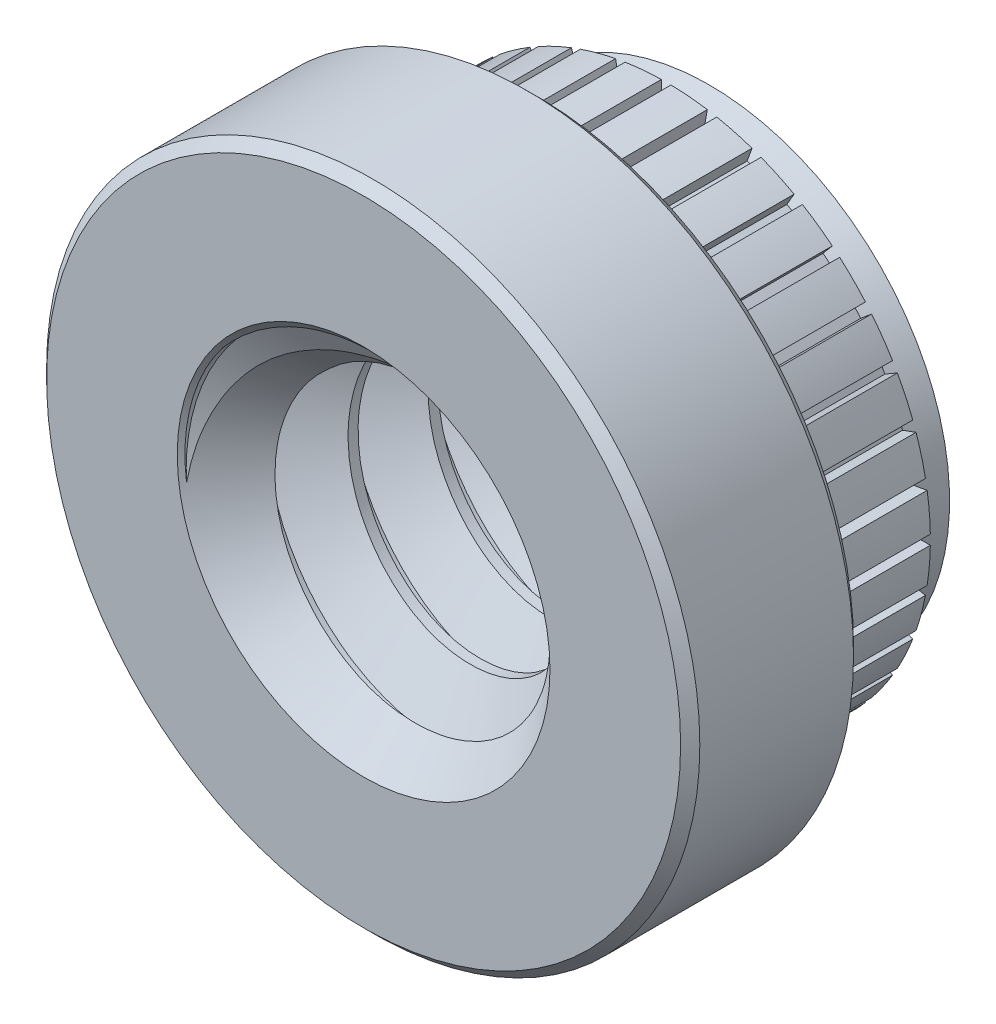
from build123d import *

# Parameters (mm, degrees)
SKETCH1_R               = 4.318
EXTRUDE1_DEPTH          = 2.286
SKETCH2_R               = 3.4925
EXTRUDE2_DEPTH          = 2.286
SKETCH3_W               = 0.127
SKETCH3_H               = 1.016
CUT_EXTRUDE_THIN1_DEPTH = 2.286
CIRPATTERN1_COUNT       = 36
SKETCH5_OUTSIDE_W       = 13.66
SKETCH5_OUTSIDE_H       = 13.66
SKETCH5_OUTSIDE_R       = 3.175
CUT_EXTRUDE1_DEPTH      = 0.5715
CUT_EXTRUDE1_DRAFT      = 20
CHAMFER2_SIZE           = 0.127
SKETCH7_R               = 2.413
CUT_EXTRUDE3_DEPTH      = 8.628461968
SWEEP1_PITCH            = 1.058333333
SKETCH10_R              = 4.318
CUT_EXTRUDE4_DEPTH      = 9.217092909
SKETCH11_R              = 3.175
CUT_EXTRUDE5_DEPTH      = 8.628462028


with BuildPart() as part:
    # Sketch1 → Extrude1 (new body)
    with BuildSketch(Plane.XY):
        Circle(SKETCH1_R)
    extrude(amount=-EXTRUDE1_DEPTH)

    # Sketch2 → Extrude2 (add)
    with BuildSketch(Plane(origin=(0, 0, -2.286), x_dir=(-1, 0, 0), z_dir=(0, 0, -1))):
        with Locations(Location((0, 0, 0), (0, 0, 180))):
            Circle(SKETCH2_R)
    extrude(amount=EXTRUDE2_DEPTH)

    # Sketch3 → Cut-Extrude-Thin1 (cut)
    with BuildSketch(Plane(origin=(0, 0, -4.572), x_dir=(-1, 0, 0), z_dir=(0, 0, -1))):
        with Locations((0, 3.81)):
            Rectangle(SKETCH3_W, SKETCH3_H)
    cut_extrude_thin1 = extrude(amount=-CUT_EXTRUDE_THIN1_DEPTH, mode=Mode.SUBTRACT)

    # CirPattern1: Cut-Extrude-Thin1 ×36 about axis
    cirpattern1_axis = Axis((0, 0, 0), (0, 0, 1))
    for i in range(1, CIRPATTERN1_COUNT):
        add(cut_extrude_thin1.rotate(cirpattern1_axis, i * 360 / CIRPATTERN1_COUNT), mode=Mode.SUBTRACT)


with BuildPart() as cut_extrude1_tool:
    # Sketch5 outside → Cut-Extrude1 (with draft: the straight prism first)
    with BuildSketch(Plane(origin=(0, 0, -4.572), x_dir=(-1, 0, 0), z_dir=(0, 0, -1))):
        Rectangle(SKETCH5_OUTSIDE_W, SKETCH5_OUTSIDE_H)
        Circle(SKETCH5_OUTSIDE_R, mode=Mode.SUBTRACT)
    extrude(amount=-CUT_EXTRUDE1_DEPTH)
    # Cut-Extrude1: the draft: its side faces are tilted about the plane it starts from
    cut_extrude1_sides = [cut_extrude1_tool.faces().sort_by_distance(p)[0] for p in [
        (0, -6.83, -4.28625),
        (-6.83, 0, -4.28625),
        (0, 6.83, -4.28625),
        (6.83, 0, -4.28625),
        (3.175, 0, -4.28625),
    ]]
    draft(cut_extrude1_sides, Plane(origin=(0, 0, -4.572), x_dir=(-1, 0, 0), z_dir=(0, 0, -1)), CUT_EXTRUDE1_DRAFT)


with BuildPart() as part_1:
    add(part.part)

    # Cut-Extrude1: cut by cut_extrude1_tool
    add(cut_extrude1_tool.part, mode=Mode.SUBTRACT)

    # Chamfer2
    chamfer2_edges = [part_1.edges().sort_by_distance(p)[0] for p in [
        (-4.318, 0, 0),
        (-4.318, 0, -2.286),
    ]]
    chamfer(chamfer2_edges, length=CHAMFER2_SIZE)

    # Sketch7 → Cut-Extrude3 (cut, through all)
    with BuildSketch(Plane.XY):
        Circle(SKETCH7_R)
    extrude(amount=-CUT_EXTRUDE3_DEPTH, mode=Mode.SUBTRACT)

    # Sweep1: the profile of Sketch9 profile screwed along a right-hand helix of 7.32 turns, 6 arcs to a turn; built about Z, then put on its axis
    sweep1_z = Axis((0, 0, 0), (0, 0, 1))
    sweep1_corners = [(2.4133, 0, -0.926214872), (1.725592336, 0, -0.529166667), (1.725592336, 0, -0.396875), (2.4133, 0, 0.000173205)]
    with BuildLine(mode=Mode.PRIVATE) as sweep1_profile:
        Line(sweep1_corners[0], sweep1_corners[1])
        Line(sweep1_corners[1], sweep1_corners[2])
        Line(sweep1_corners[2], sweep1_corners[3])
        Line(sweep1_corners[3], sweep1_corners[0])
    sweep1_cap = Face(sweep1_profile.wire())
    sweep1_turn_angles = [0, 30, 60, 90, 120, 150, 180, 210, 240, 270, 300, 330, 360]
    sweep1_turn_weights = [1, 0.8660254037844387, 1, 0.8660254037844387, 1, 0.8660254037844387, 1, 0.8660254037844387, 1, 0.8660254037844387, 1, 0.8660254037844387, 1]
    sweep1_turn_rails = [Edge.make_bspline([Vector(p[0], p[1], 0).rotate(sweep1_z, sweep1_turn_angles[k]) / sweep1_turn_weights[k] + Vector(0, 0, p[2] + SWEEP1_PITCH * sweep1_turn_angles[k] / 360) for k in range(13)], [0, 0, 0, 1, 1, 2, 2, 3, 3, 4, 4, 5, 5, 6, 6, 6], 2, sweep1_turn_weights) for p in sweep1_corners]
    sweep1_turn_sides = [Face.make_surface_from_curves(sweep1_turn_rails[p[0]], sweep1_turn_rails[p[1]]) for p in [(0, 1), (1, 2), (2, 3), (3, 0)]]
    sweep1_last_angles = [2520, 2550, 2580, 2607.6, 2635.2]
    sweep1_last_weights = [1, 0.8660254037844387, 1, 0.8862035792311934, 1]
    sweep1_last_rails = [Edge.make_bspline([Vector(p[0], p[1], 0).rotate(sweep1_z, sweep1_last_angles[k]) / sweep1_last_weights[k] + Vector(0, 0, p[2] + SWEEP1_PITCH * sweep1_last_angles[k] / 360) for k in range(5)], [0, 0, 0, 1, 1, 2, 2, 2], 2, sweep1_last_weights) for p in sweep1_corners]
    sweep1_last_sides = [Face.make_surface_from_curves(sweep1_last_rails[p[0]], sweep1_last_rails[p[1]]) for p in [(0, 1), (1, 2), (2, 3), (3, 0)]]
    sweep1 = Plane(origin=(0, 0, -4.572), x_dir=(0, 1, 0), z_dir=(0, 0, 1)) * Solid(Shell([*[p.moved(Location((0, 0, SWEEP1_PITCH * i))) for i in range(7) for p in sweep1_turn_sides], *sweep1_last_sides, sweep1_cap, sweep1_cap.rotate(sweep1_z, 2635.2).moved(Location((0, 0, SWEEP1_PITCH * 2635.2 / 360)))]))
    add(sweep1)

    # Sketch10 → Cut-Extrude4 (cut, through all)
    with BuildSketch(Plane.XY):
        Circle(SKETCH10_R)
    extrude(amount=CUT_EXTRUDE4_DEPTH, mode=Mode.SUBTRACT)

    # Sketch11 → Cut-Extrude5 (cut, through all)
    with BuildSketch(Plane(origin=(0, 0, -4.572), x_dir=(-1, 0, 0), z_dir=(0, 0, -1))):
        Circle(SKETCH11_R)
    extrude(amount=CUT_EXTRUDE5_DEPTH, mode=Mode.SUBTRACT)

    # Cut-Extrude6 cone 1 section (through the dimple's axis) → Cut-Extrude6 (revolve, cut)
    with BuildSketch(Plane(origin=(0, 0, 0), x_dir=(0, -1, 0), z_dir=(1, 0, 0))):
        Polygon((0, 0), (2.4638, 0), (0, 2.4638), align=None)
    revolve(axis=Axis((0, 0, 0), (0, 0, -1)), mode=Mode.SUBTRACT)

    # Cut-Extrude7 cone 1 section (through the dimple's axis) → Cut-Extrude7 (revolve, cut)
    with BuildSketch(Plane(origin=(0, 0, -4.572), x_dir=(0, 1, 0), z_dir=(1, 0, 0))):
        Polygon((0, 0), (2.4638, 0), (0, 2.4638), align=None)
    revolve(axis=Axis((0, 0, -4.572), (0, 0, 1)), mode=Mode.SUBTRACT)


solid = part_1.part
